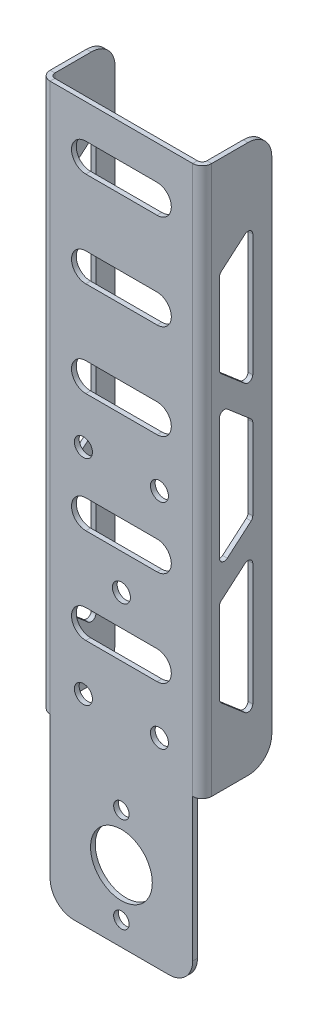
from build123d import *

# Parameters (mm, degrees)
SKETCH1_R                  = 6.5
BASE_FLANGE1_DEPTH         = 1
FILLET1_R                  = 5
SKETCHED_START             = 16.78876
SKETCHED_BEND1_OUTLINE_W   = 115.36
SKETCHED_BEND1_OUTLINE_H   = 1
SKETCHED_BEND1_DEPTH       = 13.21124
SKETCHED_START_2           = -30
SKETCHED_BEND1_2_OUTLINE_W = 115.36
SKETCHED_BEND1_2_OUTLINE_H = 1
SKETCHED_BEND1_2_DEPTH     = 13.18876
SKETCHED_START_3           = 16
SKETCHED_BEND1_3_DEPTH     = 0.0274
SKETCHED_START_4           = -16.01124
SKETCHED_BEND1_4_DEPTH     = 0.01124
SKETCHED_START_5           = -17
SKETCHED_BEND1_5_DEPTH     = 2
SKETCHED_START_6           = 15
SKETCHED_BEND1_6_DEPTH     = 2
SKETCHED_START_7           = -40.18
SKETCHED_BEND1_7_DEPTH     = 115.36
F_4_CLEARANCE_HOLE1_D      = 3.2639
FILLET2_R                  = 1
F_6_CLEARANCE_HOLE2_D      = 3.7973
CUT_EXTRUDE1_DEPTH         = 10


with BuildPart() as part:
    # Base-Flange1: sheet metal written as solids
    # Sketch1 → Base-Flange1 (new body)
    with BuildSketch(Plane.XY):
        Polygon((-30, 75.18), (30, 75.18), (30, -40.18), (15, -40.18), (15, -75.18), (-15, -75.18), (-15, -40.18), (-30, -40.18), align=None)
        with Locations((0, -60.18)):
            Circle(SKETCH1_R, mode=Mode.SUBTRACT)
        Polygon((-26, 60.18), (-19, 54.18), (-19, 36.18), (-26, 30.18), align=None, mode=Mode.SUBTRACT)
        Polygon((-26, 24.18), (-19, 30.18), (-19, 0.18), (-26, 6.18), align=None, mode=Mode.SUBTRACT)
        Polygon((-26, -29.82), (-26, 0.18), (-19, -5.82), (-19, -23.82), align=None, mode=Mode.SUBTRACT)
        Polygon((19, -23.82), (26, -29.82), (26, 0.18), (19, -5.82), align=None, mode=Mode.SUBTRACT)
        Polygon((19, 0.18), (26, 6.18), (26, 24.18), (19, 30.18), align=None, mode=Mode.SUBTRACT)
        Polygon((19, 36.18), (26, 30.18), (26, 60.18), (19, 54.18), align=None, mode=Mode.SUBTRACT)
    extrude(amount=-BASE_FLANGE1_DEPTH)

    # Fillet1
    fillet1_edges = [part.edges().sort_by_distance(p)[0] for p in [
        (-30, 75.18, -0.5),
        (30, 75.18, -0.5),
        (30, -40.18, -0.5),
        (15, -75.18, -0.5),
        (-15, -75.18, -0.5),
        (-30, -40.18, -0.5),
    ]]
    fillet(fillet1_edges, radius=FILLET1_R)

    # Sketched Bend1: read off the stored shape, not the designer's step
    # Sketched Bend1 outline → Sketched Bend1 (cut)
    with BuildSketch(Plane.YZ.offset(SKETCHED_START)):
        with Locations((17.5, -0.5)):
            Rectangle(SKETCHED_BEND1_OUTLINE_W, SKETCHED_BEND1_OUTLINE_H)
    extrude(amount=SKETCHED_BEND1_DEPTH, mode=Mode.SUBTRACT)

    # Sketched Bend1 2 outline → Sketched Bend1 2 (cut)
    with BuildSketch(Plane.YZ.offset(SKETCHED_START_2)):
        with Locations((17.5, -0.5)):
            Rectangle(SKETCHED_BEND1_2_OUTLINE_W, SKETCHED_BEND1_2_OUTLINE_H)
    extrude(amount=SKETCHED_BEND1_2_DEPTH, mode=Mode.SUBTRACT)

    # Sketched Bend1 3 outline → Sketched Bend1 3 (add)
    with BuildSketch(Plane.YZ.offset(SKETCHED_START_3)):
        with BuildLine():
            Line((75.18, -9.64380551), (75.18, -1))
            Line((75.18, -1), (-40.18, -1))
            Line((-40.18, -1), (-40.18, -9.64380551))
            ThreePointArc((-40.18, -9.64380551), (-38.715533906, -13.179339416), (-35.18, -14.64380551))
            Line((-35.18, -14.64380551), (70.18, -14.64380551))
            ThreePointArc((70.18, -14.64380551), (73.715533906, -13.179339416), (75.18, -9.64380551))
        make_face()
        Polygon((-23.82, -3.64380551), (-5.82, -3.64380551), (0.18, -10.64380551), (-29.82, -10.64380551), align=None, mode=Mode.SUBTRACT)
        Polygon((0.18, -3.64380551), (30.18, -3.64380551), (24.18, -10.64380551), (6.18, -10.64380551), align=None, mode=Mode.SUBTRACT)
        Polygon((36.18, -3.64380551), (54.18, -3.64380551), (60.18, -10.64380551), (30.18, -10.64380551), align=None, mode=Mode.SUBTRACT)
    extrude(amount=SKETCHED_BEND1_3_DEPTH)

    # Sketched Bend1 4 outline → Sketched Bend1 4 (add)
    with BuildSketch(Plane.YZ.offset(SKETCHED_START_4)):
        with BuildLine():
            Line((75.18, -9.64380551), (75.18, -1))
            Line((75.18, -1), (-40.18, -1))
            Line((-40.18, -1), (-40.18, -9.64380551))
            ThreePointArc((-40.18, -9.64380551), (-38.715533906, -13.179339416), (-35.18, -14.64380551))
            Line((-35.18, -14.64380551), (70.18, -14.64380551))
            ThreePointArc((70.18, -14.64380551), (73.715533906, -13.179339416), (75.18, -9.64380551))
        make_face()
        Polygon((-23.82, -3.64380551), (-5.82, -3.64380551), (0.18, -10.64380551), (-29.82, -10.64380551), align=None, mode=Mode.SUBTRACT)
        Polygon((0.18, -3.64380551), (30.18, -3.64380551), (24.18, -10.64380551), (6.18, -10.64380551), align=None, mode=Mode.SUBTRACT)
        Polygon((36.18, -3.64380551), (54.18, -3.64380551), (60.18, -10.64380551), (30.18, -10.64380551), align=None, mode=Mode.SUBTRACT)
    extrude(amount=SKETCHED_BEND1_4_DEPTH)

    # Sketched Bend1 5 outline → Sketched Bend1 5 (add)
    with BuildSketch(Plane.YZ.offset(SKETCHED_START_5)):
        with BuildLine():
            Line((75.18, -9.64380551), (75.18, -1))
            Line((75.18, -1), (-40.18, -1))
            Line((-40.18, -1), (-40.18, -9.64380551))
            ThreePointArc((-40.18, -9.64380551), (-38.715533906, -13.179339416), (-35.18, -14.64380551))
            Line((-35.18, -14.64380551), (70.18, -14.64380551))
            ThreePointArc((70.18, -14.64380551), (73.715533906, -13.179339416), (75.18, -9.64380551))
        make_face()
        Polygon((-23.82, -3.64380551), (-5.82, -3.64380551), (0.18, -10.64380551), (-29.82, -10.64380551), align=None, mode=Mode.SUBTRACT)
        Polygon((0.18, -3.64380551), (30.18, -3.64380551), (24.18, -10.64380551), (6.18, -10.64380551), align=None, mode=Mode.SUBTRACT)
        Polygon((36.18, -3.64380551), (54.18, -3.64380551), (60.18, -10.64380551), (30.18, -10.64380551), align=None, mode=Mode.SUBTRACT)
    extrude(amount=SKETCHED_BEND1_5_DEPTH)

    # Sketched Bend1 6 outline → Sketched Bend1 6 (add)
    with BuildSketch(Plane.YZ.offset(SKETCHED_START_6)):
        with BuildLine():
            Line((75.18, -9.64380551), (75.18, -1))
            Line((75.18, -1), (-40.18, -1))
            Line((-40.18, -1), (-40.18, -9.64380551))
            ThreePointArc((-40.18, -9.64380551), (-38.715533906, -13.179339416), (-35.18, -14.64380551))
            Line((-35.18, -14.64380551), (70.18, -14.64380551))
            ThreePointArc((70.18, -14.64380551), (73.715533906, -13.179339416), (75.18, -9.64380551))
        make_face()
        Polygon((-23.82, -3.64380551), (-5.82, -3.64380551), (0.18, -10.64380551), (-29.82, -10.64380551), align=None, mode=Mode.SUBTRACT)
        Polygon((0.18, -3.64380551), (30.18, -3.64380551), (24.18, -10.64380551), (6.18, -10.64380551), align=None, mode=Mode.SUBTRACT)
        Polygon((36.18, -3.64380551), (54.18, -3.64380551), (60.18, -10.64380551), (30.18, -10.64380551), align=None, mode=Mode.SUBTRACT)
    extrude(amount=SKETCHED_BEND1_6_DEPTH)

    # Sketched Bend1 7 outline → Sketched Bend1 7 (cut)
    with BuildSketch(Plane(origin=(0, 0, 0), x_dir=(1, 0, 0), z_dir=(0, 1, 0)).offset(SKETCHED_START_7)):
        with BuildLine():
            ThreePointArc((-16, 2), (-15.707106781, 1.292893219), (-15, 1))
            Line((-15, 1), (-15, 14.64380551))
            Line((-15, 14.64380551), (-16, 14.64380551))
            Line((-16, 14.64380551), (-16, 2))
        make_face()
        with BuildLine():
            ThreePointArc((17, 2), (16.414213562, 0.585786438), (15, 0))
            Line((15, 0), (16.78876, 0))
            Line((16.78876, 0), (16.78876, 1))
            Line((16.78876, 1), (17, 1))
            Line((17, 1), (17, 2))
        make_face()
        with BuildLine():
            ThreePointArc((-15, 0), (-16.414213562, 0.585786438), (-17, 2))
            Line((-17, 2), (-17, 1))
            Line((-17, 1), (-16.81124, 1))
            Line((-16.81124, 1), (-16.81124, 0))
            Line((-16.81124, 0), (-15, 0))
        make_face()
        with BuildLine():
            ThreePointArc((15, 1), (15.707106781, 1.292893219), (16, 2))
            Line((16, 2), (16, 14.64380551))
            Line((16, 14.64380551), (15, 14.64380551))
            Line((15, 14.64380551), (15, 1))
        make_face()
    extrude(amount=SKETCHED_BEND1_7_DEPTH, mode=Mode.SUBTRACT)

    # #4 Clearance Hole1 (through all)
    with Locations(Plane.XY):
        with Locations((0, -50.18), (0, -70.18)):
            Hole(F_4_CLEARANCE_HOLE1_D / 2)

    # Fillet2
    fillet2_edges = [part.edges().sort_by_distance(p)[0] for p in [
        (-16.5, 36.18, -3.64380551),
        (-16.5, 30.18, -10.64380551),
        (-16.5, 60.18, -10.64380551),
        (-16.5, 54.18, -3.64380551),
        (-16.5, 30.18, -3.64380551),
        (-16.5, 0.18, -3.64380551),
        (-16.5, 6.18, -10.64380551),
        (-16.5, 24.18, -10.64380551),
        (-16.5, -29.82, -10.64380551),
        (-16.5, 0.18, -10.64380551),
        (-16.5, -5.82, -3.64380551),
        (-16.5, -23.82, -3.64380551),
        (16.5, -29.82, -10.64380551),
        (16.5, -23.82, -3.64380551),
        (16.5, -5.82, -3.64380551),
        (16.5, 0.18, -10.64380551),
        (16.5, 6.18, -10.64380551),
        (16.5, 0.18, -3.64380551),
        (16.5, 30.18, -3.64380551),
        (16.5, 24.18, -10.64380551),
        (16.5, 30.18, -10.64380551),
        (16.5, 36.18, -3.64380551),
        (16.5, 54.18, -3.64380551),
        (16.5, 60.18, -10.64380551),
    ]]
    fillet(fillet2_edges, radius=FILLET2_R)

    # #6 Clearance Hole2 (through all)
    with Locations(Plane.XY):
        with Locations((-8, 12), (8, 12), (0, -10.5), (-8, -33), (8, -33)):
            Hole(F_6_CLEARANCE_HOLE2_D / 2)

    # Sketch13 → Cut-Extrude1 (cut)
    with BuildSketch(Plane.XY):
        with BuildLine():
            Line((-7.5, 3), (7.5, 3))
            ThreePointArc((7.5, 3), (10.5, 0), (7.5, -3))
            Line((7.5, -3), (-7.5, -3))
            ThreePointArc((-7.5, -3), (-10.5, 0), (-7.5, 3))
        make_face()
        with BuildLine():
            Line((-7.5, -17), (7.5, -17))
            ThreePointArc((7.5, -17), (10.5, -20), (7.5, -23))
            Line((7.5, -23), (-7.5, -23))
            ThreePointArc((-7.5, -23), (-10.5, -20), (-7.5, -17))
        make_face()
        with BuildLine():
            Line((-7.5, 28), (7.5, 28))
            ThreePointArc((7.5, 28), (10.5, 25), (7.5, 22))
            Line((7.5, 22), (-7.5, 22))
            ThreePointArc((-7.5, 22), (-10.5, 25), (-7.5, 28))
        make_face()
        with BuildLine():
            Line((-7.5, 48), (7.5, 48))
            ThreePointArc((7.5, 48), (10.5, 45), (7.5, 42))
            Line((7.5, 42), (-7.5, 42))
            ThreePointArc((-7.5, 42), (-10.5, 45), (-7.5, 48))
        make_face()
        with BuildLine():
            Line((-7.5, 68), (7.5, 68))
            ThreePointArc((7.5, 68), (10.5, 65), (7.5, 62))
            Line((7.5, 62), (-7.5, 62))
            ThreePointArc((-7.5, 62), (-10.5, 65), (-7.5, 68))
        make_face()
    extrude(amount=-CUT_EXTRUDE1_DEPTH, mode=Mode.SUBTRACT)


solid = part.part
